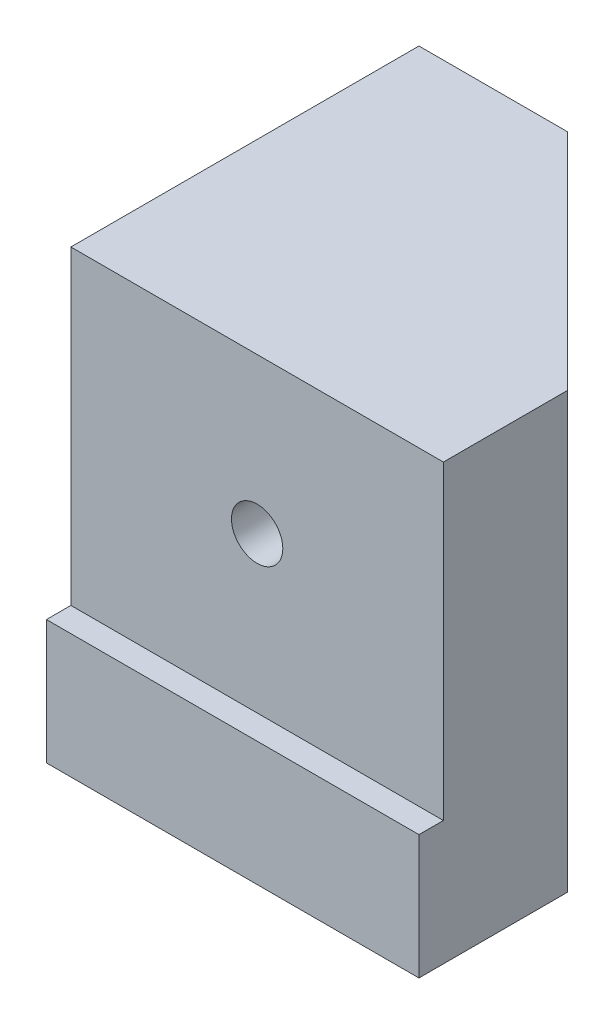
from build123d import *

# Parameters (mm, degrees)
SKETCH1_W           = 76.2
SKETCH1_H           = 76.2
BOSS_EXTRUDE1_DEPTH = 88.9
SKETCH2_R           = 5.25
CUT_EXTRUDE1_DEPTH  = 300
SKETCH3_W           = 76.2
SKETCH3_H           = 63.5
CUT_EXTRUDE2_DEPTH  = 5
CUT_EXTRUDE4_DEPTH  = 140.7


with BuildPart() as part:
    # Sketch1 → Boss-Extrude1 (new body)
    with BuildSketch(Plane(origin=(0, 0, 0), x_dir=(1, 0, 0), z_dir=(0, 1, 0))):
        with Locations((38.1, 38.1)):
            Rectangle(SKETCH1_W, SKETCH1_H)
    extrude(amount=BOSS_EXTRUDE1_DEPTH)

    # Sketch2 → Cut-Extrude1 (cut)
    with BuildSketch(Plane.XY):
        with Locations((38.1, 57.15)):
            Circle(SKETCH2_R)
    extrude(amount=-CUT_EXTRUDE1_DEPTH, mode=Mode.SUBTRACT)

    # Sketch3 → Cut-Extrude2 (cut)
    with BuildSketch(Plane.XY):
        with Locations((38.1, 57.15)):
            Rectangle(SKETCH3_W, SKETCH3_H)
    extrude(amount=-CUT_EXTRUDE2_DEPTH, mode=Mode.SUBTRACT)

    # Sketch4 → Cut-Extrude4 (cut, through all)
    with BuildSketch(Plane(origin=(0, 88.9, 0), x_dir=(1, 0, 0), z_dir=(0, 1, 0))):
        Polygon((30.4, 76.2), (76.2, 30.4), (76.2, 76.2), align=None)
    extrude(amount=-CUT_EXTRUDE4_DEPTH, mode=Mode.SUBTRACT)


solid = part.part
